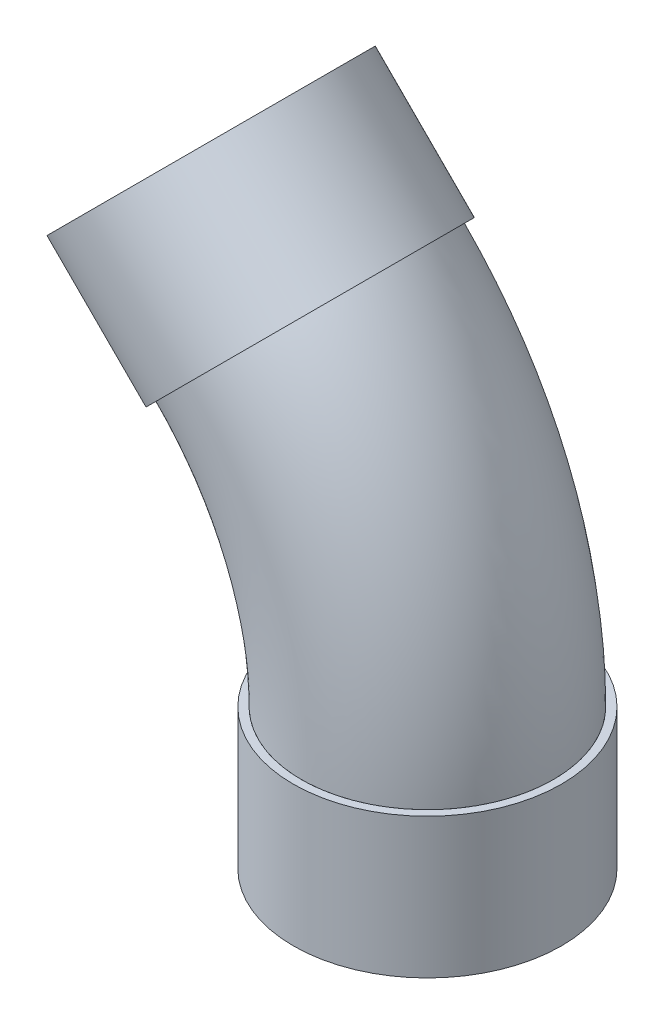
from build123d import *

# Parameters (mm, degrees)
ESQUISSE3_R              = 31.5
ESQUISSE3_R_2            = 29.5
ESQUISSE6_R              = 33.5
ESQUISSE6_R_2            = 31.5
BOSS_EXTRU_1_DEPTH       = 35
BOSS_EXTRU_3_START       = -35
BOSS_EXTRU_3_OUTLINE_R   = 33.5
BOSS_EXTRU_3_OUTLINE_R_2 = 31.5
BOSS_EXTRU_3_DEPTH       = 35


# Read off the part's stored shape, not the designer's step: Boss.-Extru.3
with BuildPart() as part:
    # Balayage1: sweep along a path in Esquisse2
    with BuildLine(Plane.XY) as balayage1_path:
        ThreePointArc((100, 0), (92.387953251, 38.268343237), (70.710678119, 70.710678119))
    # Esquisse3 → Balayage1 (sweep)
    with BuildSketch(Plane(origin=(0, 0, 0), x_dir=(1, 0, 0), z_dir=(0, 1, 0))):
        with Locations((100, 0)):
            Circle(ESQUISSE3_R)
        with Locations((100, 0)):
            Circle(ESQUISSE3_R_2, mode=Mode.SUBTRACT)
    sweep(path=balayage1_path.line)


with BuildPart() as body_2:
    # Esquisse6 → Boss.-Extru.1 (new body)
    with BuildSketch(Plane(origin=(0, 0, 0), x_dir=(1, 0, 0), z_dir=(0, 1, 0))):
        with Locations(Location((100, 0, 0), (0, 0, 270))):
            Circle(ESQUISSE6_R)
        with Locations(Location((100, 0, 0), (0, 0, 270))):
            Circle(ESQUISSE6_R_2, mode=Mode.SUBTRACT)
    extrude(amount=-BOSS_EXTRU_1_DEPTH)


with BuildPart() as body_3:
    # Boss.-Extru.3 outline → Boss.-Extru.3 (new body)
    with BuildSketch(Plane(origin=(0, 0, 0), x_dir=(0.707106781186546, 0.707106781186549, 0), z_dir=(0.707106781186549, -0.707106781186546, 0)).offset(BOSS_EXTRU_3_START)):
        with Locations((100, 0)):
            Circle(BOSS_EXTRU_3_OUTLINE_R)
        with Locations((100, 0)):
            Circle(BOSS_EXTRU_3_OUTLINE_R_2, mode=Mode.SUBTRACT)
    extrude(amount=BOSS_EXTRU_3_DEPTH)


solid = Compound([part.part, body_2.part, body_3.part])
